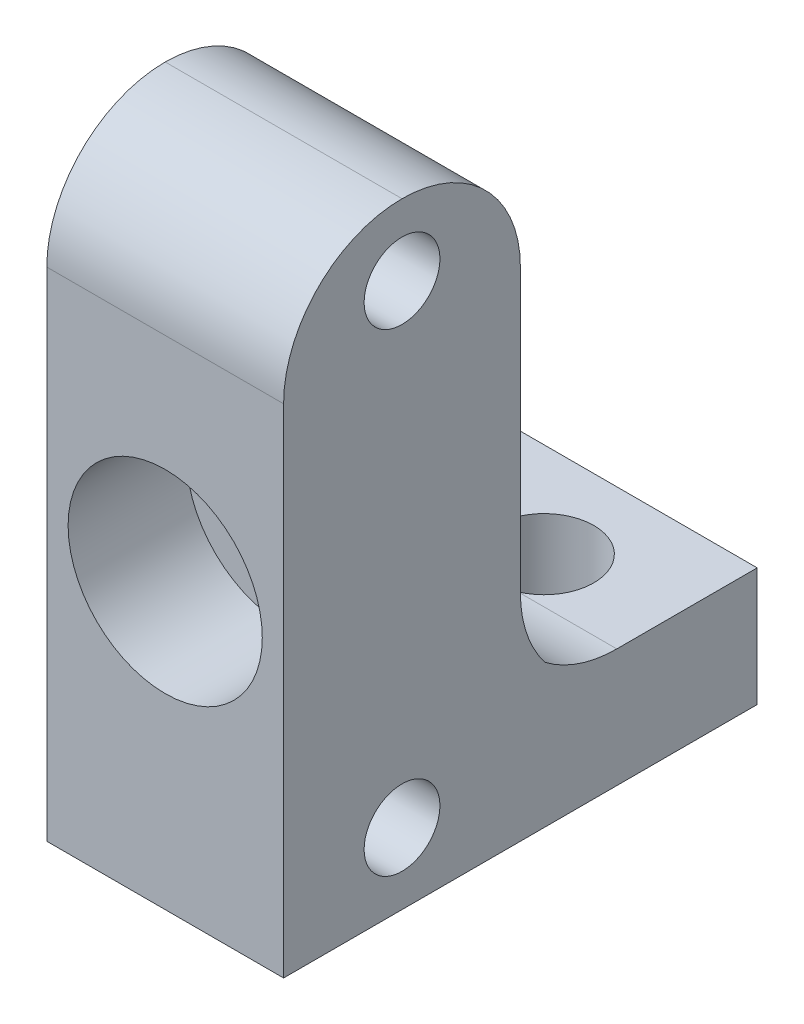
from build123d import *

# Parameters (mm, degrees)
ESQUISSE1_W             = 10
ESQUISSE1_H             = 26
ESQUISSE1_R             = 4.1
BOSS_EXTRU_1_DEPTH      = 10
ESQUISSE2_R             = 1.6
ENL_V_MAT_EXTRU_1_DEPTH = 10
ESQUISSE3_W             = 10
ESQUISSE3_H             = 10
BOSS_EXTRU_2_DEPTH      = 5
CHANFREIN1_SIZE         = 2
ESQUISSE4_R             = 2.1
ENL_V_MAT_EXTRU_2_DEPTH = 5
ESQUISSE5_R             = 4.106671815
BOSS_EXTRU_3_DEPTH      = 5
CONG_1_R                = 5


# Some blends are built 0.0001 mm under size
with BuildPart() as part:
    # Esquisse1 → Boss.-Extru.1 (new body)
    with BuildSketch(Plane.XY):
        with Locations((5, 13)):
            Rectangle(ESQUISSE1_W, ESQUISSE1_H)
        with Locations((5, 12)):
            Circle(ESQUISSE1_R, mode=Mode.SUBTRACT)
    extrude(amount=BOSS_EXTRU_1_DEPTH)

    # Esquisse2 → Enlèv. mat.-Extru.1 (cut)
    with BuildSketch(Plane.ZY):
        with Locations((5, 23)):
            Circle(ESQUISSE2_R)
        with Locations((5, 3)):
            Circle(ESQUISSE2_R)
    extrude(amount=-ENL_V_MAT_EXTRU_1_DEPTH, mode=Mode.SUBTRACT)

    # Esquisse3 → Boss.-Extru.2 (add)
    with BuildSketch(Plane.XZ):
        with Locations((5, -5)):
            Rectangle(ESQUISSE3_W, ESQUISSE3_H)
    extrude(amount=-BOSS_EXTRU_2_DEPTH)

    # Chanfrein1
    chanfrein1_edges = [part.edges().sort_by_distance(p)[0] for p in [
        (5, 5, 0),
    ]]
    chamfer(chanfrein1_edges, length=CHANFREIN1_SIZE)

    # Esquisse4 → Enlèv. mat.-Extru.2 (cut)
    with BuildSketch(Plane(origin=(0, 5, 0), x_dir=(1, 0, 0), z_dir=(0, 1, 0))):
        with Locations(Location((5, 6, 0), (0, 0, 270))):
            Circle(ESQUISSE4_R)
    extrude(amount=-ENL_V_MAT_EXTRU_2_DEPTH, mode=Mode.SUBTRACT)

    # Esquisse5 → Boss.-Extru.3 (add)
    with BuildSketch(Plane(origin=(0, 0, 0), x_dir=(-1, 0, 0), z_dir=(0, 0, -1))):
        with Locations((-5, 12)):
            Circle(ESQUISSE5_R)
    extrude(amount=-BOSS_EXTRU_3_DEPTH)

    # Congé1
    cong_1_edges = [part.edges().sort_by_distance(p)[0] for p in [
        (5, 5, -2),
    ]]
    fillet(cong_1_edges, radius=CONG_1_R)
    cong_1_2_edges = [part.edges().sort_by_distance(p)[0] for p in [
        (5, 26, 0),
    ]]
    fillet(cong_1_2_edges, radius=CONG_1_R)
    cong_1_3_edges = [part.edges().sort_by_distance(p)[0] for p in [
        (5, 26, 10),
    ]]
    fillet(cong_1_3_edges, radius=CONG_1_R - 0.0001)  # a hair under: the kernel refuses the full size
    # the kernel refuses this fillet: 5 mm, written as the material it adds along each edge
    with BuildSketch(Plane(origin=(10, 7, 0), x_dir=(0, 1, 0), z_dir=(-1, 0, 0))) as cong_1_4_piece_1:
        with BuildLine():
            CenterArc((CONG_1_R * 0.414213562373, CONG_1_R), CONG_1_R, 225, 45)
            Line((-CONG_1_R * 0.292893218813, CONG_1_R * 0.292893218813), (-CONG_1_R * 0.307035354437, CONG_1_R * 0.27875108319))
            Line((-CONG_1_R * 0.307035354437, CONG_1_R * 0.27875108319), (-CONG_1_R * 0.00828427124746, -CONG_1_R * 0.02))
            Line((-CONG_1_R * 0.00828427124746, -CONG_1_R * 0.02), (CONG_1_R * 0.414213562373, -CONG_1_R * 0.02))
            Line((CONG_1_R * 0.414213562373, -CONG_1_R * 0.02), (CONG_1_R * 0.414213562373, 0))
        make_face()
    extrude(amount=10)


solid = part.part
